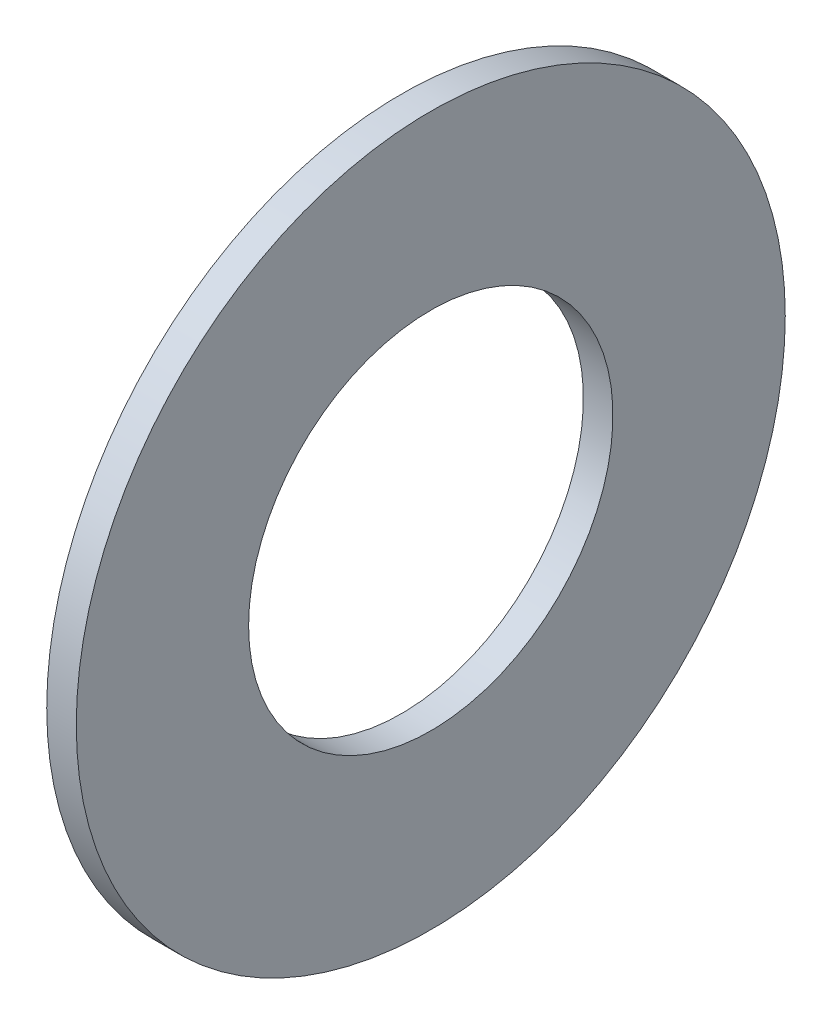
from build123d import *

# Parameters (mm, degrees)
SKETCH1_W = 3
SKETCH1_H = 17.5


with BuildPart() as part:
    # Sketch1 → Base-Revolve (revolve)
    with BuildSketch(Plane.XY):
        with Locations((-1.5, 27.25)):
            Rectangle(SKETCH1_W, SKETCH1_H)
    revolve(axis=Axis((-34.925, 0, 0), (1, 0, 0)))


solid = part.part
